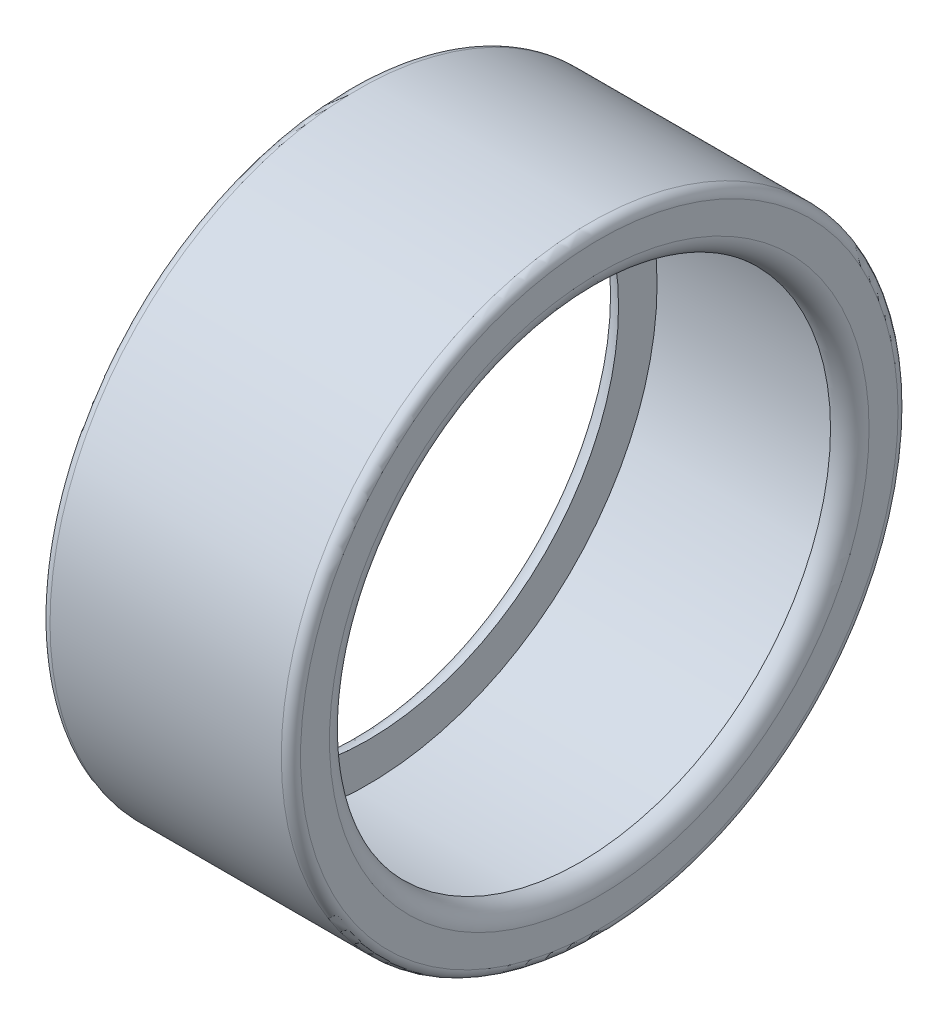
from build123d import *

# Parameters (mm, degrees)
SKETCH1_R           = 32
SKETCH1_R_2         = 26
BOSS_EXTRUDE1_DEPTH = 26
FILLET1_R           = 1
FILLET2_R           = 2
SHELL1_START        = 2
SHELL1_OUTLINE_R    = 30
SHELL1_OUTLINE_R_2  = 26
SHELL1_DEPTH        = 22


# Read off the part's stored shape, not the designer's step: Shell1
with BuildPart() as part:
    # Sketch1 → Boss-Extrude1 (new body)
    with BuildSketch(Plane(origin=(0, 0, 0), x_dir=(0, 0, -1), z_dir=(1, 0, 0))):
        with Locations(Location((0, 0, 0), (0, 0, 180))):
            Circle(SKETCH1_R)
        with Locations(Location((0, 0, 0), (0, 0, 180))):
            Circle(SKETCH1_R_2, mode=Mode.SUBTRACT)
    extrude(amount=BOSS_EXTRUDE1_DEPTH)

    # Fillet1
    fillet1_edges = [part.edges().sort_by_distance(p)[0] for p in [
        (0, 0, -32),
        (26, 0, -32),
    ]]
    fillet(fillet1_edges, radius=FILLET1_R)

    # Fillet2
    fillet2_edges = [part.edges().sort_by_distance(p)[0] for p in [
        (0, 0, -26),
        (26, 0, -26),
    ]]
    fillet(fillet2_edges, radius=FILLET2_R)

    # Shell1 outline → Shell1 (cut)
    with BuildSketch(Plane.YZ.offset(SHELL1_START)):
        Circle(SHELL1_OUTLINE_R)
        Circle(SHELL1_OUTLINE_R_2, mode=Mode.SUBTRACT)
    extrude(amount=SHELL1_DEPTH, mode=Mode.SUBTRACT)


solid = part.part
